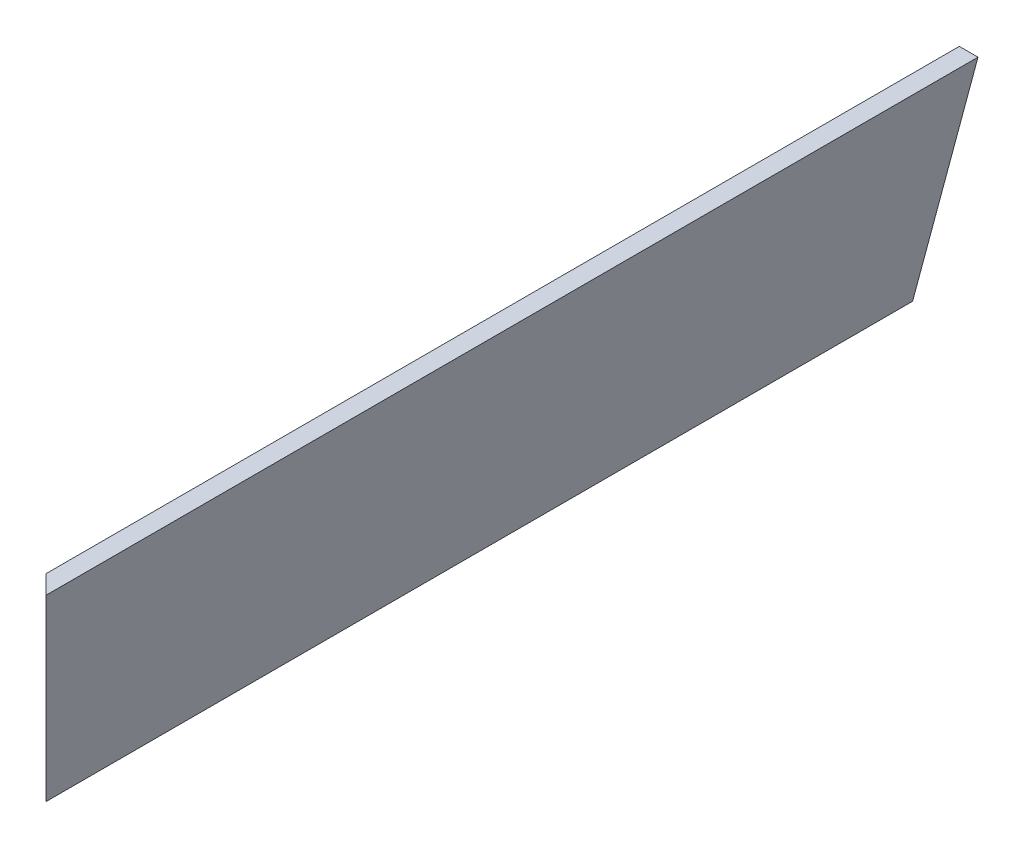
from build123d import *

# Parameters (mm, degrees)
BOSS_EXTRUDE1_REACH = 883.923


with BuildPart() as part:
    # Boss-Extrude1: up to this plane
    boss_extrude1_end = Plane(origin=(0, 0, 0), z_dir=(-0.7071067811865475, 0, 0.7071067811865477))
    # Sketch2 → Boss-Extrude1 (new, up to the surface)
    with BuildSketch(Plane.XY, mode=Mode.PRIVATE) as boss_extrude1_sk1:
        Polygon((596.451992509, 0), (609.6, 0), (655.618026219, 171.741611914), (642.470018728, 171.741611914), align=None)
    boss_extrude1_tool1 = split(extrude(boss_extrude1_sk1.sketch, amount=BOSS_EXTRUDE1_REACH, mode=Mode.PRIVATE), bisect_by=boss_extrude1_end, keep=Keep.BOTH, mode=Mode.PRIVATE)
    add(boss_extrude1_tool1.solids().sort_by_distance((626.035009, 85.870806, 0))[0])


solid = part.part
